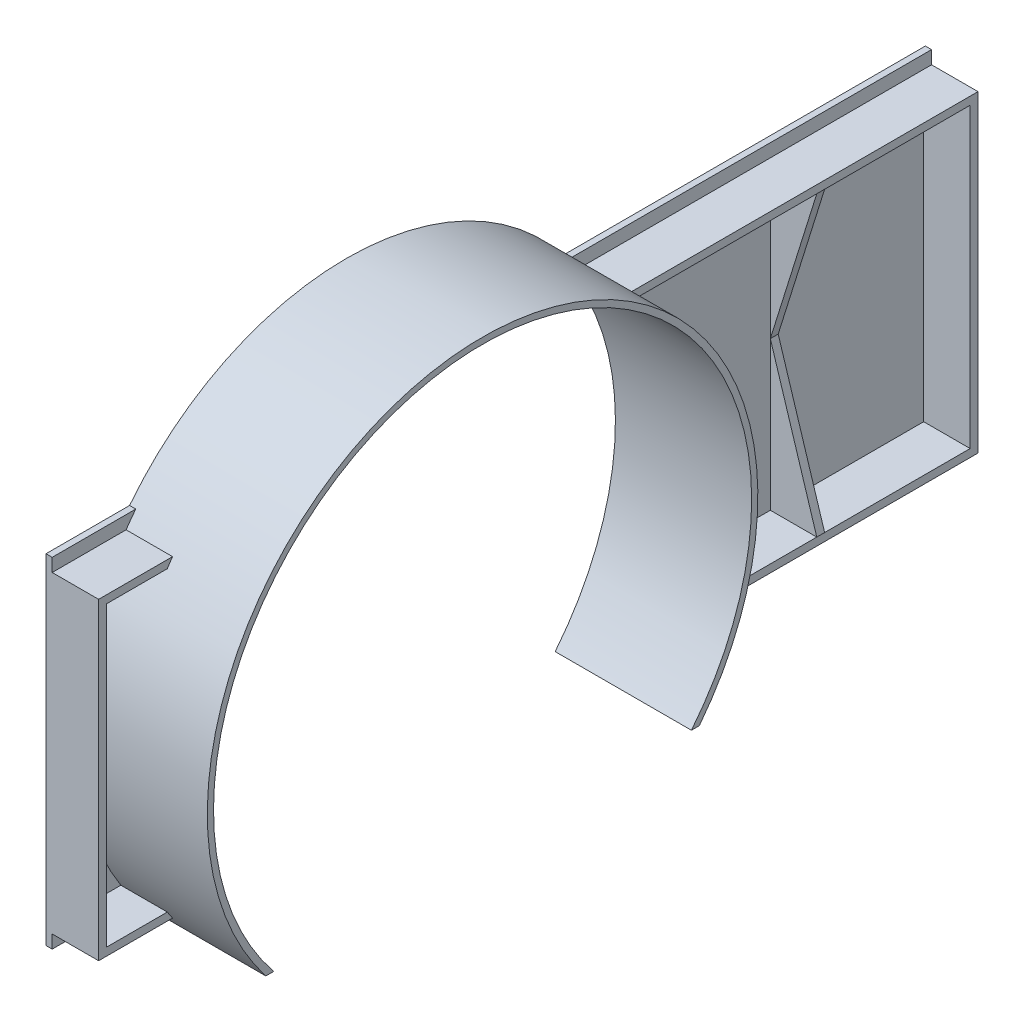
from build123d import *
from build123d.topology import SkipClean

# Parameters (mm, degrees)
BOSS_EXTRUDE1_DEPTH = 42.000000074
BOSS_EXTRUDE2_START = 2.000000064
BOSS_EXTRUDE2_DEPTH = 2.000000064
BOSS_EXTRUDE3_DEPTH = 15
BOSS_EXTRUDE4_DEPTH = 15
BOSS_EXTRUDE5_DEPTH = 15
BOSS_EXTRUDE6_DEPTH = 15
RIB1_START          = -1.27
RIB1_DEPTH          = 2.54
RIB2_START          = -1.27
RIB2_DEPTH          = 2.54
SKETCH18_W          = 2.54
SKETCH18_H          = 96.020000238
BOSS_EXTRUDE7_DEPTH = 15
SKETCH19_W          = 2.54
SKETCH19_H          = 96.020000238
BOSS_EXTRUDE8_DEPTH = 15


# Read off the part's stored shape, not the designer's step: Rib1, Rib2
with BuildPart() as part:
    # Sketch1 → Boss-Extrude1 (new body)
    with BuildSketch(Plane.ZY):
        with BuildLine():
            Line((-45.001214275, 0), (-42.443087035, 0))
            ThreePointArc((-42.443087035, 0), (25, 141.699999936), (92.443087035, 0))
            Line((92.443087035, 0), (95.001214275, 0))
            ThreePointArc((95.001214275, 0), (25, 143.7), (-45.001214275, 0))
        make_face()
    extrude(amount=-BOSS_EXTRUDE1_DEPTH)

    # Sketch2 → Boss-Extrude2 (add)
    with SkipClean():  # the faces are left unmerged after this step: merging them gives an invalid solid
        with BuildSketch(Plane.ZY.offset(BOSS_EXTRUDE2_START)):
            with BuildLine():
                Line((-160, 0), (-45.001214275, 0))
                ThreePointArc((-45.001214275, 0), (-63.9, 54.800000001), (-45.001214274, 109.600000001))
                Line((-45.001214275, 109.600000002), (-160, 109.600000002))
                Line((-160, 109.600000002), (-162.000000064, 109.600000002))
                Line((-162.000000064, 109.600000002), (-162.000000064, 0))
                Line((-162.000000064, 0), (-160, 0))
            make_face()
            with BuildLine():
                ThreePointArc((-45.001214275, 0), (25, 143.7), (95.001214275, 0))
                Line((95.001214275, 0), (92.443087035, 0))
                ThreePointArc((92.443087035, 0), (25, 141.699999936), (-42.443087035, 0))
                Line((-42.443087035, 0), (-45.001214275, 0))
            make_face()
            with BuildLine():
                ThreePointArc((95.001214275, 109.6), (113.9, 54.8), (95.001214275, 0))
                Line((95.001214275, 0), (120, 0))
                Line((120, 0), (122.000000064, 0))
                Line((122.000000064, 0), (122.000000064, 109.6))
                Line((122.000000064, 109.6), (120, 109.6))
                Line((120, 109.6), (95.001214275, 109.6))
            make_face()
        extrude(amount=-BOSS_EXTRUDE2_DEPTH)

    # Sketch7 → Boss-Extrude3 (add)
    with SkipClean():  # the faces are left unmerged after this step: merging them gives an invalid solid
        with BuildSketch(Plane(origin=(0, 0, 0), x_dir=(0, 0, -1), z_dir=(1, 0, 0))):
            with BuildLine():
                Line((49.821453399, 6.789999882), (162.000000064, 6.789999882))
                Line((162.000000064, 6.789999882), (162.000000064, 4.249999882))
                Line((162.000000064, 4.249999882), (48.129388676, 4.249999882))
                ThreePointArc((48.129388676, 4.249999882), (48.986321828, 5.512738133), (49.821453399, 6.789999882))
            make_face()
        extrude(amount=BOSS_EXTRUDE3_DEPTH)

    # Sketch10 → Boss-Extrude4 (add)
    with SkipClean():  # the faces are left unmerged after this step: merging them gives an invalid solid
        with BuildSketch(Plane(origin=(0, 0, 0), x_dir=(0, 0, -1), z_dir=(1, 0, 0))):
            with BuildLine():
                Line((-99.821453399, 6.789999882), (-122.000000064, 6.789999882))
                Line((-122.000000064, 6.789999882), (-122.000000064, 4.249999882))
                Line((-122.000000064, 4.249999882), (-98.129388676, 4.249999882))
                ThreePointArc((-98.129388676, 4.249999882), (-98.986321828, 5.512738133), (-99.821453399, 6.789999882))
            make_face()
        extrude(amount=BOSS_EXTRUDE4_DEPTH)

    # Sketch12 → Boss-Extrude5 (add)
    with SkipClean():  # the faces are left unmerged after this step: merging them gives an invalid solid
        with BuildSketch(Plane(origin=(0, 0, 0), x_dir=(0, 0, -1), z_dir=(1, 0, 0))):
            with BuildLine():
                Line((-122.000000064, 105.35000012), (-98.129388674, 105.35000012))
                ThreePointArc((-98.129388674, 105.35000012), (-98.986321827, 104.087261869), (-99.821453397, 102.81000012))
                Line((-99.821453397, 102.81000012), (-122.000000064, 102.81000012))
                Line((-122.000000064, 102.81000012), (-122.000000064, 105.35000012))
            make_face()
        extrude(amount=BOSS_EXTRUDE5_DEPTH)

    # Sketch14 → Boss-Extrude6 (add)
    with SkipClean():  # the faces are left unmerged after this step: merging them gives an invalid solid
        with BuildSketch(Plane(origin=(0, 0, 0), x_dir=(0, 0, -1), z_dir=(1, 0, 0))):
            with BuildLine():
                Line((162.000000064, 105.35000012), (48.129388674, 105.35000012))
                ThreePointArc((48.129388674, 105.35000012), (48.986321827, 104.087261869), (49.821453397, 102.81000012))
                Line((49.821453397, 102.81000012), (162.000000064, 102.81000012))
                Line((162.000000064, 102.81000012), (162.000000064, 105.35000012))
            make_face()
        extrude(amount=BOSS_EXTRUDE6_DEPTH)

    # Rib1 outline → Rib1 (add)
    with SkipClean():  # the faces are left unmerged after this step: merging them gives an invalid solid
        with BuildSketch(Plane(origin=(0, 0, -111.200000064), x_dir=(-1, 0, 0), z_dir=(0, 0, -1)).offset(RIB1_START)):
            Polygon((0, 102.81000012), (-15, 102.81000012), (0, 54.800000001), align=None)
        extrude(amount=RIB1_DEPTH)

    # Rib2 outline → Rib2 (add)
    with SkipClean():  # the faces are left unmerged after this step: merging them gives an invalid solid
        with BuildSketch(Plane(origin=(0, 0, -111.200000064), x_dir=(-1, 0, 0), z_dir=(0, 0, -1)).offset(RIB2_START)):
            Polygon((0, 54.800000001), (-15, 6.789999882), (0, 6.789999882), align=None)
        extrude(amount=RIB2_DEPTH)

    # Sketch18 → Boss-Extrude7 (add)
    with SkipClean():  # the faces are left unmerged after this step: merging them gives an invalid solid
        with BuildSketch(Plane(origin=(0, 0, 0), x_dir=(0, 0, -1), z_dir=(1, 0, 0))):
            with Locations((160.730000064, 54.800000001)):
                Rectangle(SKETCH18_W, SKETCH18_H)
        extrude(amount=BOSS_EXTRUDE7_DEPTH)

    # Sketch19 → Boss-Extrude8 (add)
    with SkipClean():  # the faces are left unmerged after this step: merging them gives an invalid solid
        with BuildSketch(Plane(origin=(0, 0, 0), x_dir=(0, 0, -1), z_dir=(1, 0, 0))):
            with Locations((-120.730000064, 54.800000001)):
                Rectangle(SKETCH19_W, SKETCH19_H)
        extrude(amount=BOSS_EXTRUDE8_DEPTH)


solid = part.part
